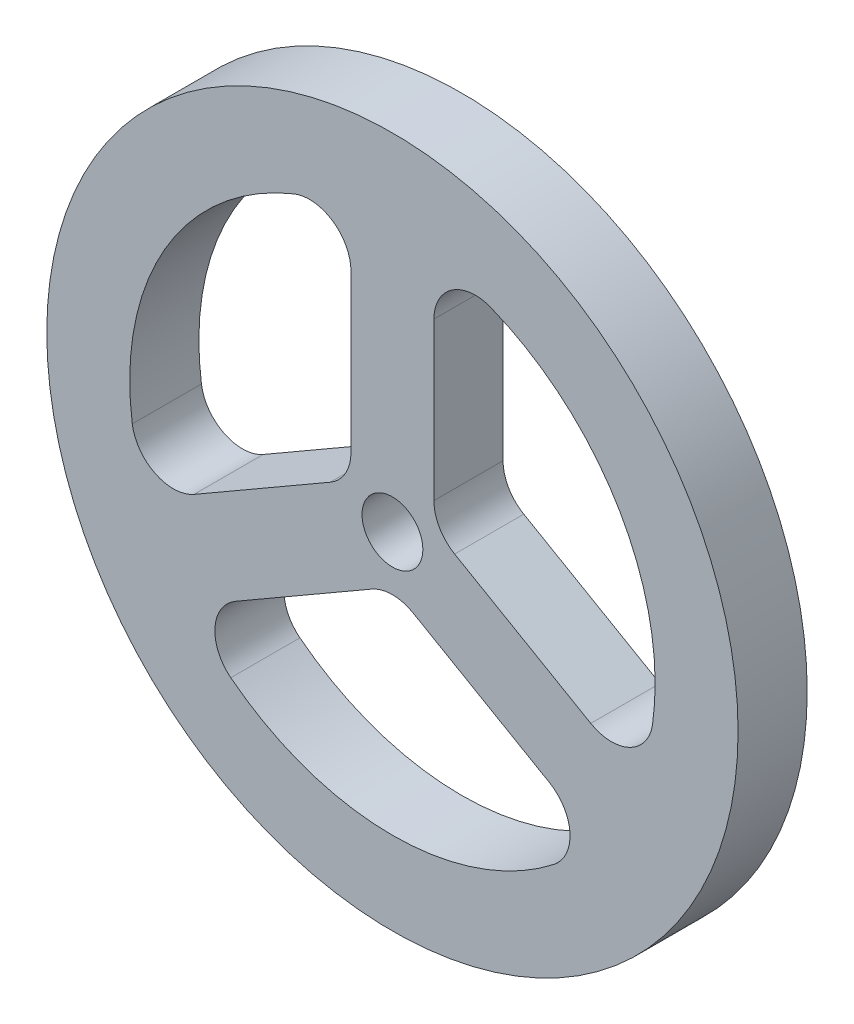
from build123d import *

# Parameters (mm, degrees)
SKETCH1_R           = 31.75
SKETCH1_R_2         = 2.794
BOSS_EXTRUDE3_DEPTH = 6.35
FILLET1_R           = 3.81


with BuildPart() as part:
    # Sketch1 → Boss-Extrude3 (new body)
    with BuildSketch(Plane.XY):
        Circle(SKETCH1_R)
        with BuildLine():
            Line((-18.730057548, -15.213212818), (0, -4.399409051))
            Line((0, -4.399409051), (18.730057548, -15.213212818))
            ThreePointArc((18.730057548, -15.213212818), (0, -24.13), (-18.730057548, -15.213212818))
        make_face(mode=Mode.SUBTRACT)
        with BuildLine():
            Line((-3.81, 23.82731206), (-3.81, 2.199704526))
            Line((-3.81, 2.199704526), (-22.540057548, -8.614099242))
            ThreePointArc((-22.540057548, -8.614099242), (-20.897192993, 12.065), (-3.81, 23.82731206))
        make_face(mode=Mode.SUBTRACT)
        Circle(SKETCH1_R_2, mode=Mode.SUBTRACT)
        with BuildLine():
            Line((22.540057548, -8.614099242), (3.81, 2.199704526))
            Line((3.81, 2.199704526), (3.81, 23.82731206))
            ThreePointArc((3.81, 23.82731206), (20.897192993, 12.065), (22.540057548, -8.614099242))
        make_face(mode=Mode.SUBTRACT)
    extrude(amount=BOSS_EXTRUDE3_DEPTH)

    # Fillet1
    fillet1_edges = [part.edges().sort_by_distance(p)[0] for p in [
        (0, -4.399409051, 3.175),
        (-18.730057548, -15.213212818, 3.175),
        (3.81, 23.82731206, 3.175),
        (3.81, 2.199704526, 3.175),
        (-22.540057548, -8.614099242, 3.175),
        (-3.81, 2.199704526, 3.175),
        (-3.81, 23.82731206, 3.175),
        (18.730057548, -15.213212818, 3.175),
        (22.540057548, -8.614099242, 3.175),
    ]]
    fillet(fillet1_edges, radius=FILLET1_R)


solid = part.part
